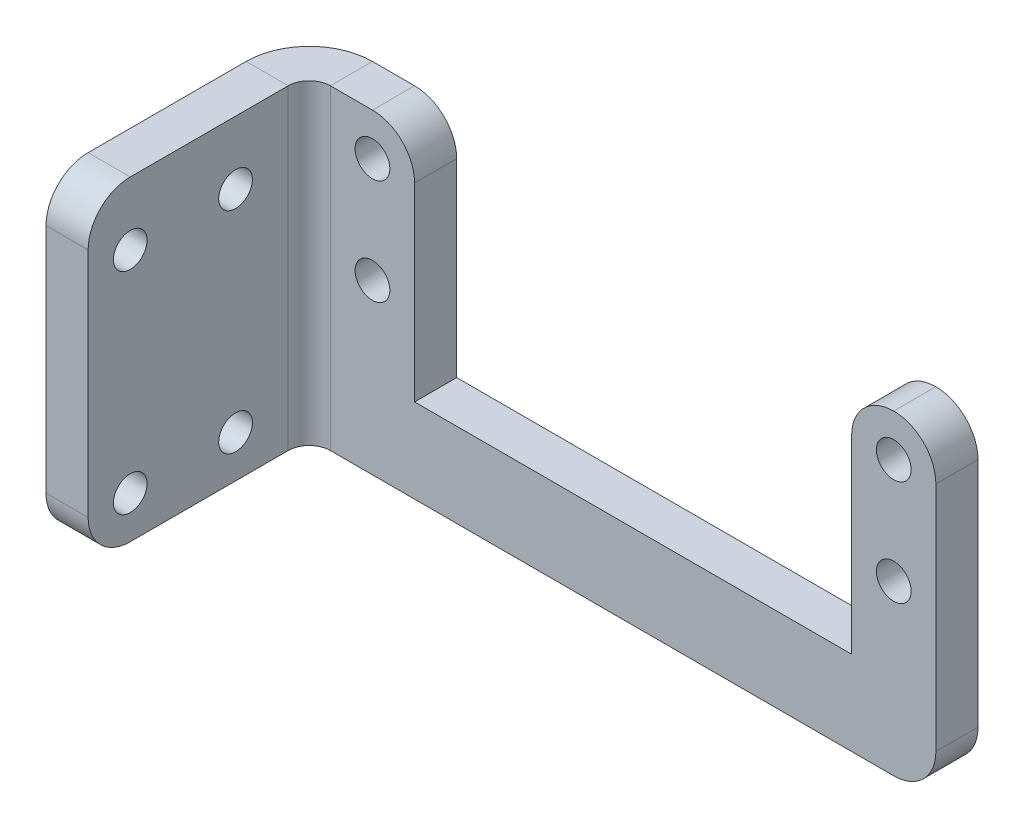
from build123d import *

# Parameters (mm, degrees)
EXTRUDE_1_DEPTH        = 4
SM_EDGE_FLANGE_1_DEPTH = 30
FILLET_1_R             = 4
SKETCH_27_R            = 1.6
CUT_EXTRUDE_1_DEPTH    = 10
M4X0_7_1_D             = 3.3


# Sheet-metal steps are written as plain solids
with BuildPart() as part:
    # Sketch 1 → 填料-伸長1 (new body)
    with BuildSketch(Plane.XY):
        Polygon((8, 0), (8, -22), (49.5, -22), (49.5, 0), (57.5, 0), (57.5, -30), (8, -30), (0, -30), (0, 0), align=None)
    extrude(amount=EXTRUDE_1_DEPTH)

    # 邊線-凸緣1 section (across the edge) → 邊線-凸緣1 (add)
    with BuildSketch(Plane(origin=(-2, 0, 4), x_dir=(1, 0, 0), z_dir=(0, -1, 0))):
        with BuildLine():
            Line((-4, 2), (-4, 21))
            Line((-4, 21), (0, 21))
            Line((0, 21), (0, 2))
            ThreePointArc((0, 2), (0.585786438, 0.585786438), (2, 0))
            Line((2, 0), (2, -4))
            ThreePointArc((2, -4), (-2.242640687, -2.242640687), (-4, 2))
        make_face()
    extrude(amount=SM_EDGE_FLANGE_1_DEPTH)

    # 圓角1
    fillet_1_edges = [part.edges().sort_by_distance(p)[0] for p in [
        (57.5, -30, 2),
        (57.5, 0, 2),
        (49.5, 0, 2),
        (8, 0, 2),
        (-4, 0, 25),
        (-4, -30, 25),
    ]]
    fillet(fillet_1_edges, radius=FILLET_1_R - 0.0001)  # a hair under: the kernel refuses the full size

    # 草圖27 → 除料-伸長1 (cut)
    with BuildSketch(Plane(origin=(-2, 0, 0), x_dir=(0, 0, -1), z_dir=(1, 0, 0))):
        with Locations((-21, -26)):
            Circle(SKETCH_27_R)
        with Locations((-11, -26)):
            Circle(SKETCH_27_R)
        with Locations((-11, -6)):
            Circle(SKETCH_27_R)
        with Locations((-21, -6)):
            Circle(SKETCH_27_R)
    extrude(amount=-CUT_EXTRUDE_1_DEPTH, mode=Mode.SUBTRACT)

    # M4x0.7 螺紋孔1 (through all)
    with Locations(Plane(origin=(53.5, -4, 0), x_dir=(-1, 0, 0), z_dir=(0, 0, -1))):
        with Locations((0, 0), (0, -10), (49.5, 0), (49.5, -10)):
            Hole(M4X0_7_1_D / 2)


solid = part.part
